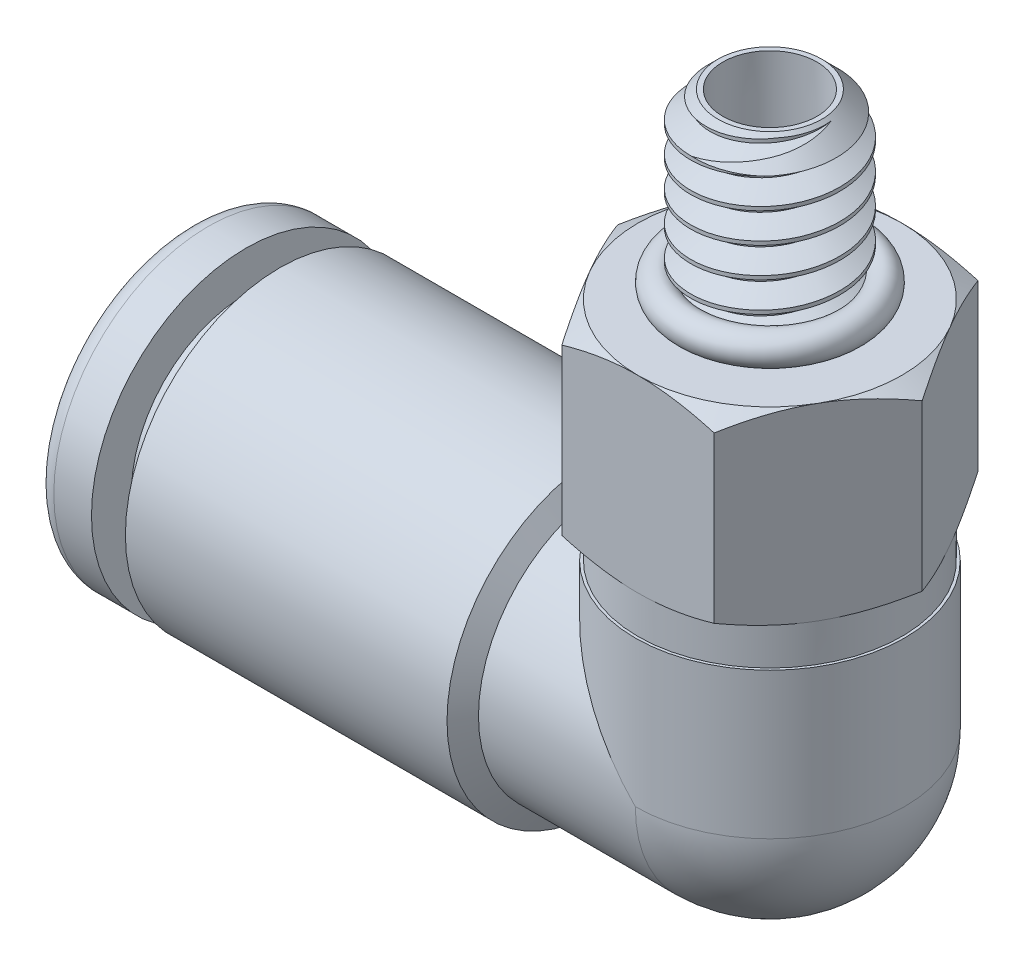
from build123d import *

# Parameters (mm, degrees)
SKETCH2_R          = 1.9812
EXTRUDE1_DEPTH     = 4.826
SKETCH5_OUTSIDE_W  = 22.788
SKETCH5_OUTSIDE_H  = 33.559
SKETCH5_OUTSIDE_R  = 1.379718294
EXTRUDE2_DEPTH     = 3.5
EXTRUDE2_DRAFT     = -45
CUT_SWEEP1_PITCH   = 0.79375
EXTRUDE4_DEPTH     = 5
SKETCH9_OUTSIDE_W  = 44.413
SKETCH9_OUTSIDE_H  = 33.172
SKETCH9_OUTSIDE_R  = 3.5
EXTRUDE5_DEPTH     = 5
EXTRUDE5_DRAFT     = -60
SKETCH10_OUTSIDE_W = 43.331
SKETCH10_OUTSIDE_H = 32.09
SKETCH10_OUTSIDE_R = 3.5
EXTRUDE6_DEPTH     = 4.68739
EXTRUDE6_DRAFT     = -60
SKETCH11_R         = 1.984375
EXTRUDE7_DEPTH     = 13.3
SKETCH13_R         = 1.25
CUT_EXTRUDE1_DEPTH = 15.4
CUT_REVOLVE1_ANGLE = 90
SKETCH15_R         = 1.25
CUT_EXTRUDE2_DEPTH = 25.715785529
CUT_EXTRUDE2_DRAFT = 0.001
SKETCH17_R         = 0.4


with BuildPart() as part:
    # Sketch1 → Revolve1 (revolve)
    with BuildSketch(Plane(origin=(0, 0, 0), x_dir=(-1, 0, 0), z_dir=(0, 0, -1)), mode=Mode.PRIVATE) as revolve1_sk:
        with BuildLine():
            Line((0, 3.6), (0, 2.484375))
            ThreePointArc((0, 2.484375), (-0.146446609, 2.130821609), (-0.5, 1.984375))
            Line((-0.5, 1.984375), (-13.3, 1.984375))
            Line((-13.3, 1.984375), (-13.3, 0))
            Line((-13.3, 0), (-18.97109375, 0))
            ThreePointArc((-18.97109375, 0), (-17.925144607, 2.525144607), (-15.4, 3.57109375))
            Line((-15.4, 3.57109375), (-11.238228062, 3.57109375))
            Line((-11.238228062, 3.57109375), (-10.932863896, 4.1))
            Line((-10.932863896, 4.1), (-2.4, 4.1))
            Line((-2.4, 4.1), (-2.4, 3.0421875))
            Line((-2.4, 3.0421875), (-1.5, 3.0421875))
            Line((-1.5, 3.0421875), (-1.5, 4.1))
            Line((-1.5, 4.1), (-0.5, 4.1))
            ThreePointArc((-0.5, 4.1), (-0.146446609, 3.953553391), (0, 3.6))
        make_face()
    revolve(revolve1_sk.sketch.rotate(Axis((0, 0, 0), (1, 0, 0)), 180), axis=Axis((0, 0, 0), (1, 0, 0)))



with BuildPart() as body_2:
    # Sketch2 → Extrude1 (new body)
    with BuildSketch(Plane(origin=(0, 9.874, 0), x_dir=(0, 0, -1), z_dir=(0, 1, 0))):
        with Locations(Location((0, -15.4, 0), (0, 0, 270))):
            Circle(SKETCH2_R)
    extrude(amount=EXTRUDE1_DEPTH)


with BuildPart() as extrude2_tool:
    # Sketch5 outside → Extrude2 (with draft: the straight prism first)
    with BuildSketch(Plane(origin=(0, 14.7, 0), x_dir=(0, 0, -1), z_dir=(0, 1, 0))):
        with Locations((0, -9.4855)):
            Rectangle(SKETCH5_OUTSIDE_W, SKETCH5_OUTSIDE_H)
        with Locations((0, -15.4)):
            Circle(SKETCH5_OUTSIDE_R, mode=Mode.SUBTRACT)
    extrude(amount=-EXTRUDE2_DEPTH)
    # Extrude2: the draft: its side faces are tilted about the plane it starts from
    extrude2_sides = [extrude2_tool.faces().sort_by_distance(p)[0] for p in [
        (26.265, 12.95, 0),
        (9.4855, 12.95, -11.394),
        (-7.294, 12.95, 0),
        (9.4855, 12.95, 11.394),
        (15.4, 12.95, 1.379718294),
    ]]
    draft(extrude2_sides, Plane(origin=(0, 14.7, 0), x_dir=(0, 0, -1), z_dir=(0, 1, 0)), EXTRUDE2_DRAFT)


with BuildPart() as body_2_1:
    add(body_2.part)

    # Extrude2: cut by extrude2_tool
    add(extrude2_tool.part, mode=Mode.SUBTRACT)

    # Cut-Sweep1: the profile of Sketch4 screwed along a right-hand helix of 7.08 turns, 8 arcs to a turn; built about Z, then put on its axis
    cut_sweep1_z = Axis((0, 0, 0), (0, 0, 1))
    cut_sweep1_corners = [(1.465644252, 0, -0.396875), (1.465644252, 0, -0.29765625), (2.067125958, 0, 0.049609375), (1.9812, 0, -0.69453125)]
    with BuildLine(mode=Mode.PRIVATE) as cut_sweep1_profile:
        Line(cut_sweep1_corners[0], cut_sweep1_corners[1])
        Line(cut_sweep1_corners[1], cut_sweep1_corners[2])
        Line(cut_sweep1_corners[2], cut_sweep1_corners[3])
        Line(cut_sweep1_corners[3], cut_sweep1_corners[0])
    cut_sweep1_cap = Face(cut_sweep1_profile.wire())
    cut_sweep1_turn_angles = [0, 22.5, 45, 67.5, 90, 112.5, 135, 157.5, 180, 202.5, 225, 247.5, 270, 292.5, 315, 337.5, 360]
    cut_sweep1_turn_weights = [1, 0.9238795325112867, 1, 0.9238795325112867, 1, 0.9238795325112867, 1, 0.9238795325112867, 1, 0.9238795325112867, 1, 0.9238795325112867, 1, 0.9238795325112867, 1, 0.9238795325112867, 1]
    cut_sweep1_turn_rails = [Edge.make_bspline([Vector(p[0], p[1], 0).rotate(cut_sweep1_z, cut_sweep1_turn_angles[k]) / cut_sweep1_turn_weights[k] + Vector(0, 0, p[2] + CUT_SWEEP1_PITCH * cut_sweep1_turn_angles[k] / 360) for k in range(17)], [0, 0, 0, 1, 1, 2, 2, 3, 3, 4, 4, 5, 5, 6, 6, 7, 7, 8, 8, 8], 2, cut_sweep1_turn_weights) for p in cut_sweep1_corners]
    cut_sweep1_turn_sides = [Face.make_surface_from_curves(cut_sweep1_turn_rails[p[0]], cut_sweep1_turn_rails[p[1]]) for p in [(0, 1), (1, 2), (2, 3), (3, 0)]]
    cut_sweep1_last_angles = [2520, 2534.4, 2548.8]
    cut_sweep1_last_weights = [1, 0.9685831611286229, 1]
    cut_sweep1_last_rails = [Edge.make_bspline([Vector(p[0], p[1], 0).rotate(cut_sweep1_z, cut_sweep1_last_angles[k]) / cut_sweep1_last_weights[k] + Vector(0, 0, p[2] + CUT_SWEEP1_PITCH * cut_sweep1_last_angles[k] / 360) for k in range(3)], [0, 0, 0, 1, 1, 1], 2, cut_sweep1_last_weights) for p in cut_sweep1_corners]
    cut_sweep1_last_sides = [Face.make_surface_from_curves(cut_sweep1_last_rails[p[0]], cut_sweep1_last_rails[p[1]]) for p in [(0, 1), (1, 2), (2, 3), (3, 0)]]
    cut_sweep1 = Plane(origin=(15.4, 14.7, 0), x_dir=(-1, 0, 0), z_dir=(0, -1, 0)) * Solid(Shell([*[p.moved(Location((0, 0, CUT_SWEEP1_PITCH * i))) for i in range(7) for p in cut_sweep1_turn_sides], *cut_sweep1_last_sides, cut_sweep1_cap, cut_sweep1_cap.rotate(cut_sweep1_z, 2548.8).moved(Location((0, 0, CUT_SWEEP1_PITCH * 2548.8 / 360)))]))
    add(cut_sweep1, mode=Mode.SUBTRACT)

    # Extrude3 cone 1 section (through the dimple's axis) → Extrude3 (revolve)
    with BuildSketch(Plane(origin=(15.4, 9.874, 0), x_dir=(0, 0, -1), z_dir=(1, 0, 0))):
        Polygon((0, 0), (1.9812, 0), (0, 1.9812), align=None)
    revolve(axis=Axis((15.4, 9.874, 0), (0, 1, 0)))


with BuildPart() as part_1:
    add(part.part)

    add(body_2_1.part)  # Revolve2 merges body 2
    # Sketch7 → Revolve2 (revolve)
    with BuildSketch(Plane.XY, mode=Mode.PRIVATE) as revolve2_sk:
        Polygon((15.4, 9.874), (15.4, 0), (18.97109375, 0), (18.97109375, 3.874), (18.9, 3.874), (18.9, 9.874), align=None)
    revolve(revolve2_sk.sketch.rotate(Axis((15.4, 9.874, 0), (0, -1, 0)), 90), axis=Axis((15.4, 9.874, 0), (0, -1, 0)))

    # Sketch8 → Extrude4 (add)
    with BuildSketch(Plane(origin=(0, 9.874, 0), x_dir=(1, 0, 0), z_dir=(0, 1, 0))):
        Polygon((19.441451884, 0), (17.420725942, 3.5), (13.379274058, 3.5), (11.358548116, 0), (13.379274058, -3.5), (17.420725942, -3.5), align=None)
    extrude(amount=-EXTRUDE4_DEPTH)


with BuildPart() as extrude5_tool:
    # Sketch9 outside → Extrude5 (with draft: the straight prism first)
    with BuildSketch(Plane(origin=(0, 9.874, 0), x_dir=(1, 0, 0), z_dir=(0, 1, 0))):
        with Locations((9.7205, 0)):
            Rectangle(SKETCH9_OUTSIDE_W, SKETCH9_OUTSIDE_H)
        with Locations(Location((15.4, 0, 0), (0, 0, 270))):
            Circle(SKETCH9_OUTSIDE_R, mode=Mode.SUBTRACT)
    extrude(amount=-EXTRUDE5_DEPTH)
    # Extrude5: the draft: its side faces are tilted about the plane it starts from
    extrude5_sides = [extrude5_tool.faces().sort_by_distance(p)[0] for p in [
        (9.7205, 7.374, 16.586),
        (31.927, 7.374, 0),
        (9.7205, 7.374, -16.586),
        (-12.486, 7.374, 0),
        (15.4, 7.374, -3.5),
    ]]
    draft(extrude5_sides, Plane(origin=(0, 9.874, 0), x_dir=(1, 0, 0), z_dir=(0, 1, 0)), EXTRUDE5_DRAFT)


with BuildPart() as part_2:
    add(part_1.part)

    # Extrude5: cut by extrude5_tool
    add(extrude5_tool.part, mode=Mode.SUBTRACT)


with BuildPart() as extrude6_tool:
    # Sketch10 outside → Extrude6 (with draft: the straight prism first)
    with BuildSketch(Plane.XZ.offset(-4.874)):
        with Locations((9.7205, 0)):
            Rectangle(SKETCH10_OUTSIDE_W, SKETCH10_OUTSIDE_H)
        with Locations(Location((15.4, 0, 0), (0, 0, 90))):
            Circle(SKETCH10_OUTSIDE_R, mode=Mode.SUBTRACT)
    extrude(amount=-EXTRUDE6_DEPTH)
    # Extrude6: the draft: its side faces are tilted about the plane it starts from
    extrude6_sides = [extrude6_tool.faces().sort_by_distance(p)[0] for p in [
        (9.7205, 7.217695, -16.045),
        (31.386, 7.217695, 0),
        (9.7205, 7.217695, 16.045),
        (-11.945, 7.217695, 0),
        (15.4, 7.217695, -3.5),
    ]]
    draft(extrude6_sides, Plane.XZ.offset(-4.874), EXTRUDE6_DRAFT)


with BuildPart() as part_3:
    add(part_2.part)

    # Extrude6: cut by extrude6_tool
    add(extrude6_tool.part, mode=Mode.SUBTRACT)

    # Sketch11 → Extrude7 (cut)
    with BuildSketch(Plane.ZY.offset(-13.3)):
        with Locations(Location((0, 0, 0), (0, 0, 270))):
            Circle(SKETCH11_R)
    extrude(amount=EXTRUDE7_DEPTH, mode=Mode.SUBTRACT)

    # Sketch13 → Cut-Extrude1 (cut)
    with BuildSketch(Plane.ZY):
        with Locations(Location((0, 0, 0), (0, 0, 270))):
            Circle(SKETCH13_R)
    extrude(amount=-CUT_EXTRUDE1_DEPTH, mode=Mode.SUBTRACT)

    # Sketch14 → Cut-Revolve1 (revolve, cut)
    with BuildSketch(Plane.ZY.offset(-15.4)):
        with BuildLine():
            Line((1.25, 0), (-1.25, 0))
            ThreePointArc((-1.25, 0), (0, -1.25), (1.25, 0))
        make_face()
    revolve(axis=Axis((15.4, 0, -1.25), (0, 0, 1)), revolution_arc=CUT_REVOLVE1_ANGLE, mode=Mode.SUBTRACT)


with BuildPart() as cut_extrude2_tool:
    # Sketch15 → Cut-Extrude2 (with draft: the straight prism first)
    with BuildSketch(Plane.XZ):
        with Locations((15.4, 0)):
            Circle(SKETCH15_R)
    extrude(amount=-CUT_EXTRUDE2_DEPTH)
    # Cut-Extrude2: the draft: its side faces are tilted about the plane it starts from
    cut_extrude2_sides = [cut_extrude2_tool.faces().sort_by_distance(p)[0] for p in [
        (14.15, 12.857892764, 0),
    ]]
    draft(cut_extrude2_sides, Plane.XZ, CUT_EXTRUDE2_DRAFT)


with BuildPart() as part_4:
    add(part_3.part)

    # Cut-Extrude2: cut by cut_extrude2_tool
    add(cut_extrude2_tool.part, mode=Mode.SUBTRACT)


with BuildPart() as body_2_2:
    # Sketch17 → Revolve4 (revolve)
    with BuildSketch(Plane.XY):
        with Locations((13.276577874, 10.274)):
            Circle(SKETCH17_R)
    revolve(axis=Axis((15.4, 14.7, 0), (0, -1, 0)))


solid = Compound([part_4.part, body_2_2.part])
